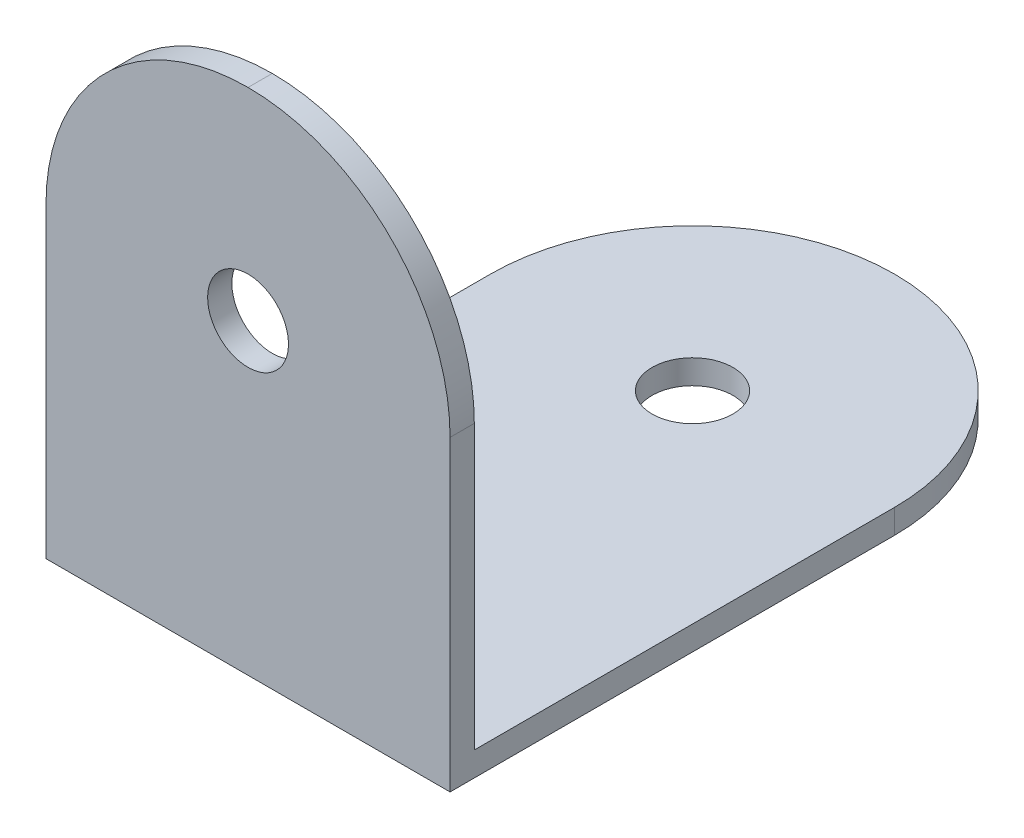
from build123d import *

# Parameters (mm, degrees)
SKETCH1_W               = 25
SKETCH1_H               = 38.5
SKETCH1_H_2             = 1.5
BOSS_EXTRUDE1_DEPTH     = 1.5
SKETCH1_3_W             = 25
SKETCH1_3_H             = 1.5
BOSS_EXTRUDE2_DEPTH     = 30
FILLET1_R               = 12.5
SKETCH2_R               = 2.5
CUT_EXTRUDE1_DEPTH      = 39.160843806
CUT_EXTRUDE2_DEPTH      = 51.383529055
CUT_EXTRUDE2_DEPTH_BACK = 51.383529055
SKETCH3_R               = 2.5


with BuildPart() as part:
    # Sketch1 → Boss-Extrude1 (new body)
    with BuildSketch(Plane(origin=(0, 0, 0), x_dir=(1, 0, 0), z_dir=(0, 1, 0))):
        with Locations((0, 0.75)):
            Rectangle(SKETCH1_W, SKETCH1_H)
        with Locations((0, -19.25)):
            Rectangle(SKETCH1_W, SKETCH1_H_2)
    extrude(amount=-BOSS_EXTRUDE1_DEPTH)

    # Sketch1<3> → Boss-Extrude2 (add)
    with BuildSketch(Plane(origin=(0, 0, 0), x_dir=(1, 0, 0), z_dir=(0, 1, 0))):
        with Locations((0, -19.25)):
            Rectangle(SKETCH1_3_W, SKETCH1_3_H)
    extrude(amount=BOSS_EXTRUDE2_DEPTH)

    # Fillet1
    fillet1_edges = [part.edges().sort_by_distance(p)[0] for p in [
        (-12.5, 30, 19.25),
        (12.5, 30, 19.25),
        (-12.5, -0.75, -20),
        (12.5, -0.75, -20),
    ]]
    fillet(fillet1_edges, radius=FILLET1_R - 0.0001)  # a hair under: the kernel refuses the full size

    # Sketch2 → Cut-Extrude1 (cut, through all)
    with BuildSketch(Plane(origin=(0, 0, 0), x_dir=(1, 0, 0), z_dir=(0, 1, 0))):
        with Locations(Location((0, 7.5, 0), (0, 0, 270))):
            Circle(SKETCH2_R)
    extrude(amount=-CUT_EXTRUDE1_DEPTH, mode=Mode.SUBTRACT)

    # Sketch3 → Cut-Extrude2 (cut, two sides: drawn at the far end of the back side and taken through both)
    with BuildSketch(Plane(origin=(0, 0, 18.5), x_dir=(-1, 0, 0), z_dir=(0, 0, -1)).offset(-CUT_EXTRUDE2_DEPTH_BACK)):
        with Locations((0, 17.5)):
            Circle(SKETCH3_R)
    extrude(amount=CUT_EXTRUDE2_DEPTH + CUT_EXTRUDE2_DEPTH_BACK, mode=Mode.SUBTRACT)


solid = part.part
